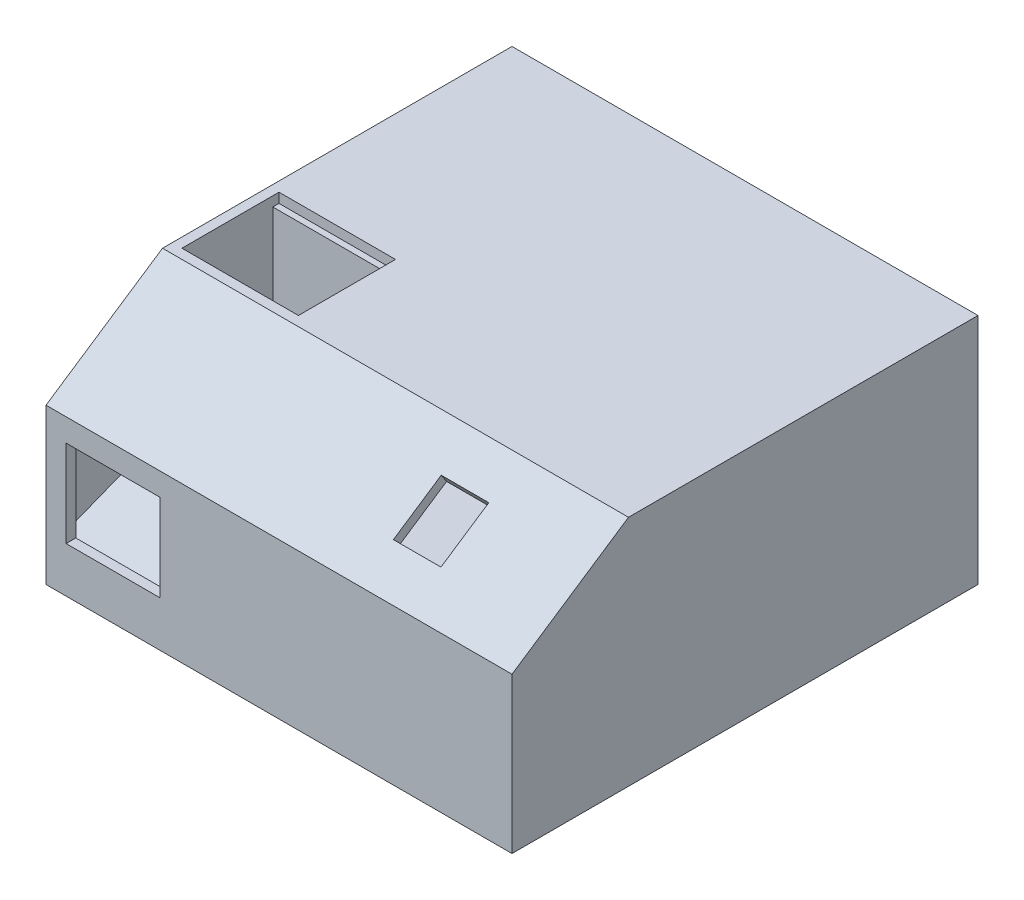
from build123d import *

# Parameters (mm, degrees)
SKETCH1_W               = 609.6
SKETCH1_H               = 609.6
BOSS_EXTRUDE1_DEPTH     = 304.8
CUT_EXTRUDE2_DEPTH      = 747.6044736
CUT_EXTRUDE2_DEPTH_BACK = 609.6
SHELL11_T               = -12.7
CUT_EXTRUDE5_REACH      = 645.809
SKETCH12_W              = 62.23
SKETCH12_H              = 75.184
CUT_EXTRUDE6_REACH      = 529.929
SKETCH13_W              = 152.4
SKETCH13_H              = 127
BOSS_EXTRUDE2_DEPTH     = 158.496
SHELL13_START           = -292.1
SHELL13_DEPTH           = 145.796
BOSS_EXTRUDE4_REACH     = 738.271
SKETCH16_W              = 123.026433271
SKETCH16_H              = 113.837135886
CUT_EXTRUDE7_DEPTH      = 158.496


# Read off the part's stored shape, not the designer's step: Shell13
with BuildPart() as part:
    # Sketch1 → Boss-Extrude1 (new body)
    with BuildSketch(Plane(origin=(0, 0, 0), x_dir=(1, 0, 0), z_dir=(0, 1, 0))):
        Rectangle(SKETCH1_W, SKETCH1_H)
    extrude(amount=BOSS_EXTRUDE1_DEPTH)

    # Sketch11 → Cut-Extrude2 (cut, two sides: drawn at the far end of the back side and taken through both)
    with BuildSketch(Plane(origin=(304.8, 0, 0), x_dir=(0, 0, -1), z_dir=(1, 0, 0)).offset(-CUT_EXTRUDE2_DEPTH_BACK)):
        Polygon((-1382.429640083, -515.219760055), (-304.8, 203.2), (-152.4, 304.8), (925.229640083, 1023.219760055), (-511.609880028, 3178.47904022), (-2819.269160193, 1640.03952011), align=None)
    extrude(amount=CUT_EXTRUDE2_DEPTH + CUT_EXTRUDE2_DEPTH_BACK, mode=Mode.SUBTRACT)

    # Shell11
    shell11_openings = [part.faces().sort_by_distance(p)[0] for p in [
        (0, 152.4, -304.8),
    ]]
    offset(amount=SHELL11_T, openings=shell11_openings, kind=Kind.INTERSECTION)

    # Sketch12 → Cut-Extrude5 (cut, up to next)
    with BuildSketch(Plane(origin=(0, 281.353846154, 187.569230769), x_dir=(1, 0, 0), z_dir=(0, 0.8320502943378435, 0.5547001962252293)), mode=Mode.PRIVATE) as cut_extrude5_sk1:
        with Locations((135.847083822, -49.312847444)):
            Rectangle(SKETCH12_W, SKETCH12_H)
    cut_extrude5_tool1 = extrude(cut_extrude5_sk1.sketch, amount=-CUT_EXTRUDE5_REACH, mode=Mode.PRIVATE) & part.part
    add(cut_extrude5_tool1.solids().sort_by_distance((135.847084, 254, 228.6))[0], mode=Mode.SUBTRACT)

    # Sketch13 → Cut-Extrude6 (cut, up to next)
    with BuildSketch(Plane(origin=(0, 304.8, 0), x_dir=(1, 0, 0), z_dir=(0, 1, 0)), mode=Mode.PRIVATE) as cut_extrude6_sk1:
        with Locations((-215.9, -76.2)):
            Rectangle(SKETCH13_W, SKETCH13_H)
    cut_extrude6_tool1 = extrude(cut_extrude6_sk1.sketch, amount=-CUT_EXTRUDE6_REACH, mode=Mode.PRIVATE) & part.part
    add(cut_extrude6_tool1.solids().sort_by_distance((-215.9, 304.8, 76.2))[0], mode=Mode.SUBTRACT)

    # Sketch14 → Boss-Extrude2 (add)
    with BuildSketch(Plane(origin=(-292.1, 0, 0), x_dir=(0, 0, -1), z_dir=(1, 0, 0))):
        Polygon((-292.1, 12.7), (-8.096776742, 12.7), (-8.096776742, 292.1), (-148.554749401, 292.1), (-292.1, 196.403166267), align=None)
    extrude(amount=BOSS_EXTRUDE2_DEPTH)

    # Shell13 outline → Shell13 (cut)
    with BuildSketch(Plane.YZ.offset(SHELL13_START)):
        Polygon((196.403166267, 292.1), (12.7, 292.1), (12.7, 20.796776742), (292.1, 20.796776742), (292.1, 148.554749401), align=None)
    extrude(amount=SHELL13_DEPTH, mode=Mode.SUBTRACT)

    # Sketch15 → Boss-Extrude4 (add, up to next)
    with BuildSketch(Plane(origin=(-292.1, 0, 0), x_dir=(0, 0, -1), z_dir=(1, 0, 0)), mode=Mode.PRIVATE) as boss_extrude4_sk1:
        Polygon((-292.1, 59.544316955), (-20.796776742, 166.882273248), (-20.796776742, 158.761495931), (-292.1, 51.423539637), align=None)
    boss_extrude4_tool1 = extrude(boss_extrude4_sk1.sketch, amount=BOSS_EXTRUDE4_REACH, mode=Mode.PRIVATE) - part.part
    add(boss_extrude4_tool1.solids().sort_by_distance((-292.1, 109.152906, 156.448388))[0])

    # Sketch16 → Cut-Extrude7 (cut)
    with BuildSketch(Plane(origin=(0, 0, 292.1), x_dir=(-1, 0, 0), z_dir=(0, 0, -1))):
        with Locations((217.055324109, 116.462884898)):
            Rectangle(SKETCH16_W, SKETCH16_H)
    extrude(amount=-CUT_EXTRUDE7_DEPTH, mode=Mode.SUBTRACT)


solid = part.part
